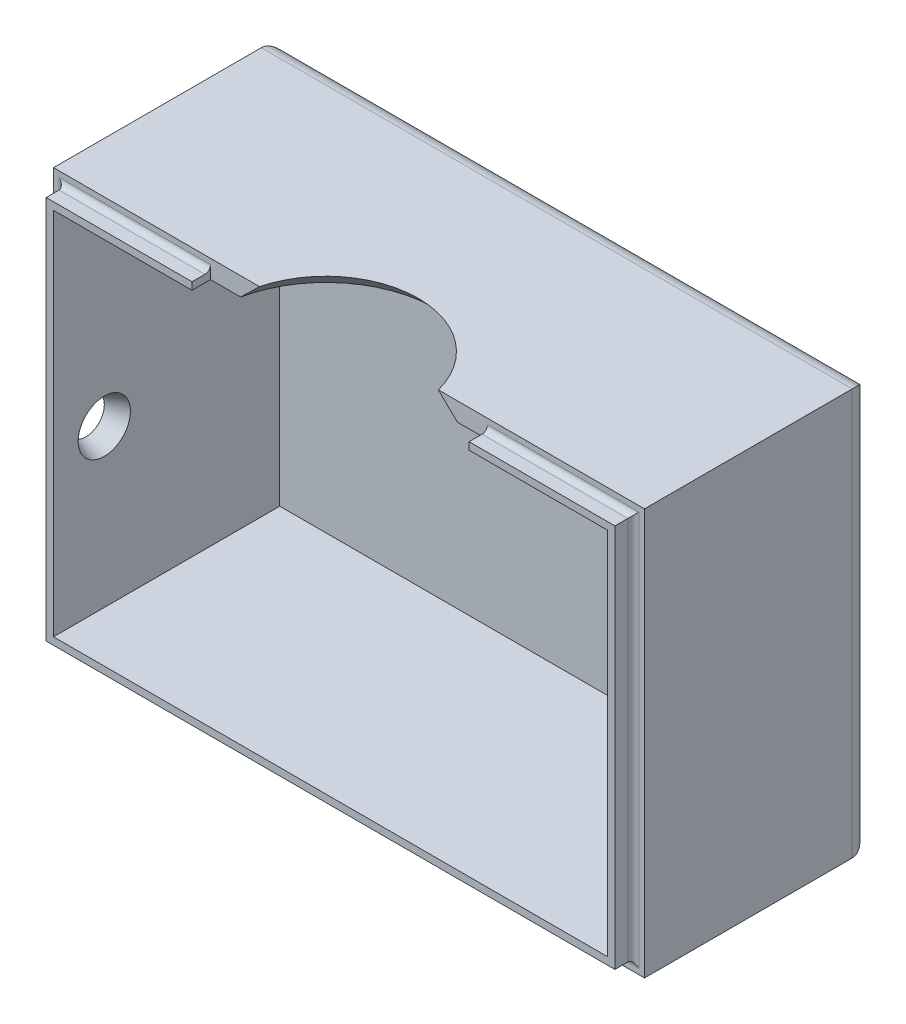
from build123d import *

# Parameters (mm, degrees)
SKETCH2_W           = 81.28
SKETCH2_H           = 55.88
SKETCH2_W_2         = 76.2
SKETCH2_H_2         = 50.8
BOSS_EXTRUDE1_DEPTH = 28.575
SKETCH3_W           = 81.28
SKETCH3_H           = 55.88
BOSS_EXTRUDE2_DEPTH = 2.54
SKETCH6_R           = 2.54
CUT_EXTRUDE2_DEPTH  = 2.54
CHAMFER2_SIZE2      = 1.052102448
CHAMFER2_SIZE       = 2.54
SKETCH7_R           = 12.7
CUT_EXTRUDE5_DEPTH  = 2.54
BOSS_EXTRUDE3_DEPTH = 2.54
CHAMFER3_SIZE       = 2.54
FILLET2_R           = 0.762
FILLET3_R           = 2.54


with BuildPart() as part:
    # Sketch2 → Boss-Extrude1 (new body)
    with BuildSketch(Plane.XY):
        with Locations((-0.567961126, 5.010592309)):
            Rectangle(SKETCH2_W, SKETCH2_H)
        with Locations((-0.567961126, 5.010592309)):
            Rectangle(SKETCH2_W_2, SKETCH2_H_2, mode=Mode.SUBTRACT)
    extrude(amount=-BOSS_EXTRUDE1_DEPTH)

    # Sketch3 → Boss-Extrude2 (add)
    with BuildSketch(Plane(origin=(0, 0, -28.575), x_dir=(-1, 0, 0), z_dir=(0, 0, -1))):
        with Locations((0.567961126, 5.010592309)):
            Rectangle(SKETCH3_W, SKETCH3_H)
    extrude(amount=BOSS_EXTRUDE2_DEPTH)

    # Sketch6 → Cut-Extrude2 (cut)
    with BuildSketch(Plane.ZY.offset(41.207961126)):
        with Locations((-4.445, 1.200592309)):
            Circle(SKETCH6_R)
    extrude(amount=-CUT_EXTRUDE2_DEPTH, mode=Mode.SUBTRACT)

    # Chamfer2
    chamfer2_edges = [part.edges().sort_by_distance(p)[0] for p in [
        (-38.667961126, 1.200592309, -6.985),
    ]]
    chamfer2_side = [part.faces().sort_by_distance(p)[0] for p in [
        (-38.689003175, 1.200592309, -6.985),
    ]]
    chamfer(chamfer2_edges, length=CHAMFER2_SIZE - 0.0001, length2=CHAMFER2_SIZE2 - 0.0001, reference=chamfer2_side[0])  # a hair under: the kernel refuses the full size

    # Sketch7 → Cut-Extrude5 (cut)
    with BuildSketch(Plane(origin=(0, 32.950592309, 0), x_dir=(1, 0, 0), z_dir=(0, 1, 0))):
        with Locations((-0.567961126, -3.175)):
            Circle(SKETCH7_R)
    extrude(amount=-CUT_EXTRUDE5_DEPTH, mode=Mode.SUBTRACT)

    # Sketch8 → Boss-Extrude3 (add)
    with BuildSketch(Plane.XY):
        Polygon((-38.667961126, 30.410592309), (-19.617961126, 30.410592309), (-19.617961126, 31.426592309), (-39.683961126, 31.426592309), (-39.683961126, -21.405407691), (38.548038874, -21.405407691), (38.548038874, 31.426592309), (18.482038874, 31.426592309), (18.482038874, 30.410592309), (37.532038874, 30.410592309), (37.532038874, -20.389407691), (-38.667961126, -20.389407691), align=None)
    extrude(amount=BOSS_EXTRUDE3_DEPTH)

    # Chamfer3
    chamfer3_edges = [part.edges().sort_by_distance(p)[0] for p in [
        (-0.567961126, 30.410592309, -9.525),
    ]]
    chamfer(chamfer3_edges, length=CHAMFER3_SIZE - 0.0001)  # a hair under: the kernel refuses the full size

    # Fillet2
    fillet2_edges = [part.edges().sort_by_distance(p)[0] for p in [
        (-29.650961126, 31.426592309, 0),
        (-39.683961126, 5.010592309, 0),
        (-0.567961126, -21.405407691, 0),
        (38.548038874, 5.010592309, 0),
        (28.515038874, 31.426592309, 0),
    ]]
    fillet(fillet2_edges, radius=FILLET2_R)

    # Fillet3
    fillet3_edges = [part.edges().sort_by_distance(p)[0] for p in [
        (40.072038874, 5.010592309, -31.115),
        (-0.567961126, -22.929407691, -31.115),
        (-41.207961126, 5.010592309, -31.115),
        (-0.567961126, 32.950592309, -31.115),
    ]]
    fillet(fillet3_edges, radius=FILLET3_R)


solid = part.part
